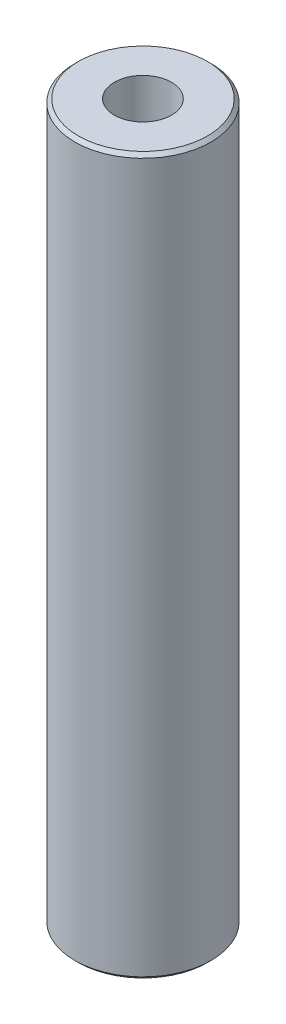
from build123d import *

# Parameters (mm, degrees)
SKETCH1_R           = 15
BOSS_EXTRUDE1_DEPTH = 157.74634423
SKETCH2_R           = 6.292994903
CUT_EXTRUDE1_DEPTH  = 160.166293913
CHAMFER1_SIZE       = 0.775249563


with BuildPart() as part:
    # Sketch1 → Boss-Extrude1 (new body)
    with BuildSketch(Plane(origin=(0, 0, 0), x_dir=(1, 0, 0), z_dir=(0, 1, 0))):
        Circle(SKETCH1_R)
    extrude(amount=BOSS_EXTRUDE1_DEPTH)

    # Sketch2 → Cut-Extrude1 (cut, through all)
    with BuildSketch(Plane(origin=(0, 0, 0), x_dir=(1, 0, 0), z_dir=(0, 1, 0))):
        Circle(SKETCH2_R)
    extrude(amount=CUT_EXTRUDE1_DEPTH, mode=Mode.SUBTRACT)

    # Chamfer1
    chamfer1_edges = [part.edges().sort_by_distance(p)[0] for p in [
        (-15, 157.74634423, 0),
        (-15, 0, 0),
    ]]
    chamfer(chamfer1_edges, length=CHAMFER1_SIZE)


solid = part.part
